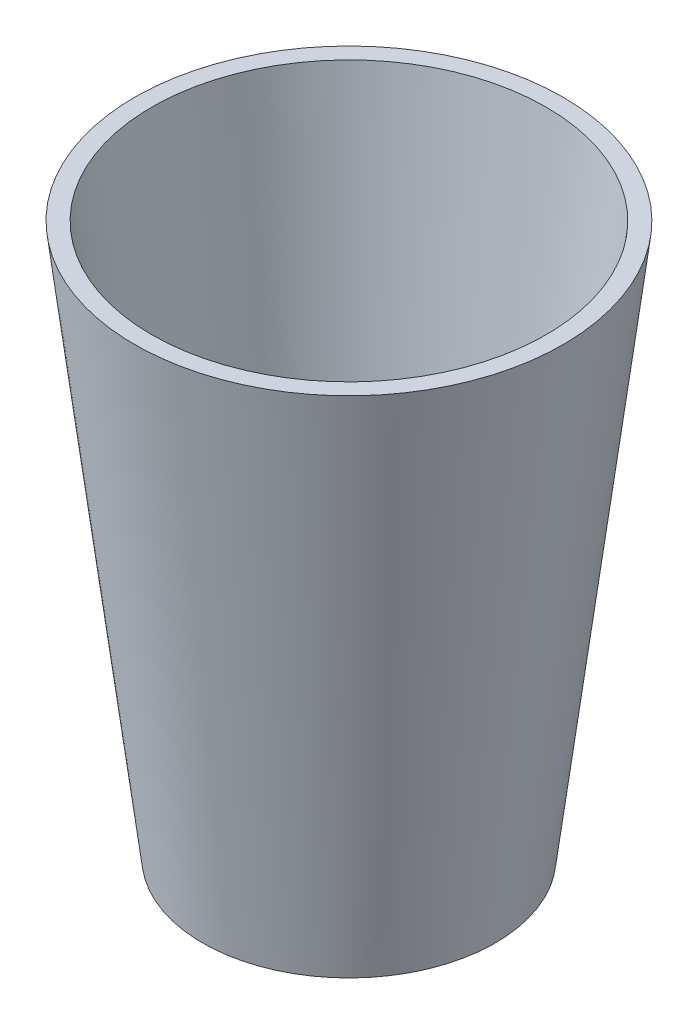
from build123d import *


with BuildPart() as part:
    # 草图2 → 旋转1 (revolve)
    with BuildSketch(Plane.XY):
        Polygon((0, 0), (23.335466714, 0), (35, 95), (38.022529476, 95), (25.989642508, -3), (0, -3), align=None)
    revolve(axis=Axis((0, 0, 0), (0, 1, 0)))


solid = part.part
